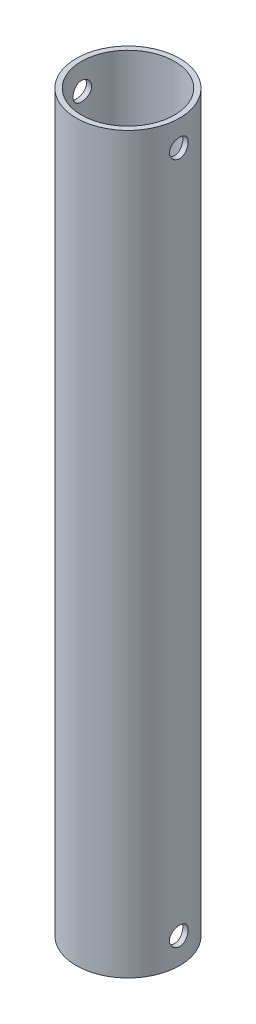
from build123d import *

# Parameters (mm, degrees)
SKETCH1_R            = 10
SKETCH1_R_2          = 9
BOSS_EXTRUDE1_DEPTH  = 142
M3_CLEARANCE_HOLE1_D = 3.6


with BuildPart() as part:
    # Sketch1 → Boss-Extrude1 (new body)
    with BuildSketch(Plane(origin=(0, 0, 0), x_dir=(1, 0, 0), z_dir=(0, 1, 0))):
        Circle(SKETCH1_R)
        Circle(SKETCH1_R_2, mode=Mode.SUBTRACT)
    extrude(amount=BOSS_EXTRUDE1_DEPTH)

    # M3 Clearance Hole1 (through all)
    with Locations(Plane(origin=(10, 0, 0), x_dir=(0, 0, -1), z_dir=(1, 0, 0))):
        with Locations((0, 5)):
            m3_clearance_hole1 = Hole(M3_CLEARANCE_HOLE1_D / 2)

    # Mirror1: M3 Clearance Hole1 across plane
    add(m3_clearance_hole1.mirror(Plane.ZX.offset(71)), mode=Mode.SUBTRACT)


solid = part.part
